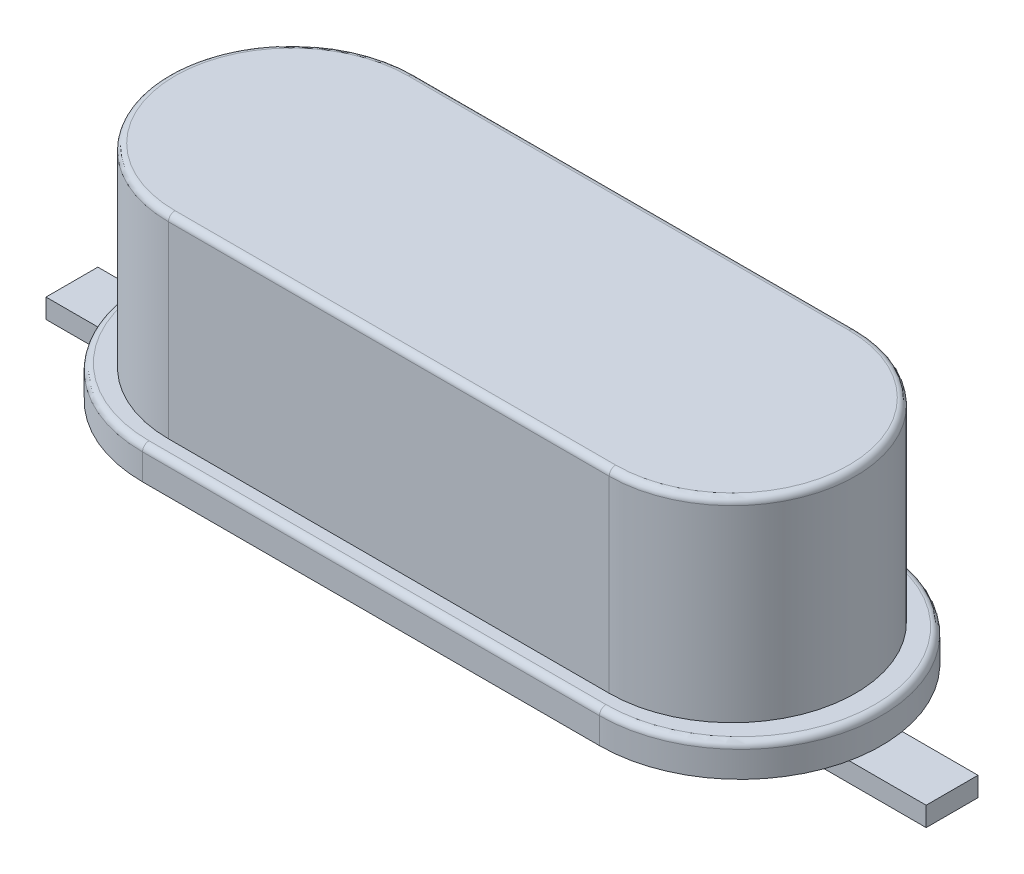
from build123d import *

# Parameters (mm, degrees)
BOSS_EXTRUDE1_DEPTH = 0.5
FILLET1_R           = 0.1
BOSS_EXTRUDE2_DEPTH = 3
FILLET2_R           = 0.1
SKETCH4_W           = 0.3
SKETCH4_H           = 0.8
BOSS_EXTRUDE3_DEPTH = 0.35
SKETCH5_W           = 0.8
SKETCH5_H           = 0.3
BOSS_EXTRUDE4_DEPTH = 4.2
FILLET3_R           = 0.2


with BuildPart() as part:
    # Sketch1 → Boss-Extrude1 (new body)
    with BuildSketch(Plane(origin=(0, 0, 0), x_dir=(1, 0, 0), z_dir=(0, 1, 0))):
        with BuildLine():
            Line((-3.525, 2.175), (3.525, 2.175))
            ThreePointArc((3.525, 2.175), (5.7, 0), (3.525, -2.175))
            Line((3.525, -2.175), (-3.525, -2.175))
            ThreePointArc((-3.525, -2.175), (-5.7, 0), (-3.525, 2.175))
        make_face()
    extrude(amount=BOSS_EXTRUDE1_DEPTH)

    # Fillet1
    fillet1_edges = [part.edges().sort_by_distance(p)[0] for p in [
        (5.7, 0.5, 0),
        (0, 0.5, -2.175),
        (-5.7, 0.5, 0),
        (0, 0.5, 2.175),
    ]]
    fillet(fillet1_edges, radius=FILLET1_R)

    # Sketch2 → Boss-Extrude2 (add)
    with BuildSketch(Plane(origin=(0, 0.5, 0), x_dir=(1, 0, 0), z_dir=(0, 1, 0))):
        with BuildLine():
            Line((-3.4, 1.9), (3.4, 1.9))
            ThreePointArc((3.4, 1.9), (5.3, 0), (3.4, -1.9))
            Line((3.4, -1.9), (-3.4, -1.9))
            ThreePointArc((-3.4, -1.9), (-5.3, 0), (-3.4, 1.9))
        make_face()
    extrude(amount=BOSS_EXTRUDE2_DEPTH)

    # Fillet2
    fillet2_edges = [part.edges().sort_by_distance(p)[0] for p in [
        (-5.3, 3.5, 0),
        (0, 3.5, 1.9),
        (5.3, 3.5, 0),
        (0, 3.5, -1.9),
    ]]
    fillet(fillet2_edges, radius=FILLET2_R)

    # Sketch4 → Boss-Extrude3 (add)
    with BuildSketch(Plane.XZ):
        with Locations((2.44, 0)):
            Rectangle(SKETCH4_W, SKETCH4_H)
        with Locations((-2.44, 0)):
            Rectangle(SKETCH4_W, SKETCH4_H)
    extrude(amount=BOSS_EXTRUDE3_DEPTH)

    # Sketch5 → Boss-Extrude4 (add)
    with BuildSketch(Plane.ZY.offset(2.59)):
        with Locations((0, -0.2)):
            Rectangle(SKETCH5_W, SKETCH5_H)
    boss_extrude4 = extrude(amount=BOSS_EXTRUDE4_DEPTH)

    # Mirror1: Boss-Extrude4 across plane
    add(boss_extrude4.mirror(Plane(origin=(0, 0, 0), x_dir=(0, 0, 1), z_dir=(1, 0, 0))))

    # Fillet3
    # the kernel refuses this fillet: 0.2 mm, written as the material it adds along each edge
    with BuildSketch(Plane(origin=(-2.59, -0.05, -0.4), x_dir=(-1, 0, 0), z_dir=(0, 0, 1))) as fillet3_piece_1:
        with BuildLine():
            CenterArc((0.132287566, -0.2), FILLET3_R, 90, 41.409622109)
            Line((0, -0.05), (0, 0))
            Line((0, 0), (0.132287566, 0))
        make_face()
    extrude(amount=0.8)
    with BuildSketch(Plane(origin=(2.59, -0.05, -0.4), x_dir=(0, 1, 0), z_dir=(0, 0, 1))) as fillet3_piece_2:
        with BuildLine():
            CenterArc((0.2, -0.132287566), FILLET3_R, 138.590377891, 41.409622109)
            Line((0, -0.132287566), (0, 0))
            Line((0, 0), (0.05, 0))
        make_face()
    extrude(amount=0.8)
    # the kernel refuses this fillet: 0.2 mm, written as the material it takes off along each edge
    with BuildSketch(Plane(origin=(2.29, -0.35, -0.9), x_dir=(0, 1, 0), z_dir=(0, 0, 1)), Plane(origin=(-2.29, -0.35, 0.9), x_dir=(0, 1, 0), z_dir=(0, 0, -1))) as fillet3_2_piece_1:
        with BuildLine():
            CenterArc((FILLET3_R, -FILLET3_R), FILLET3_R, 90, 90)
            Line((0, -FILLET3_R), (0, 0))
            Line((0, 0), (FILLET3_R, 0))
        make_face()
    extrude(amount=1.8, mode=Mode.SUBTRACT)


solid = part.part
